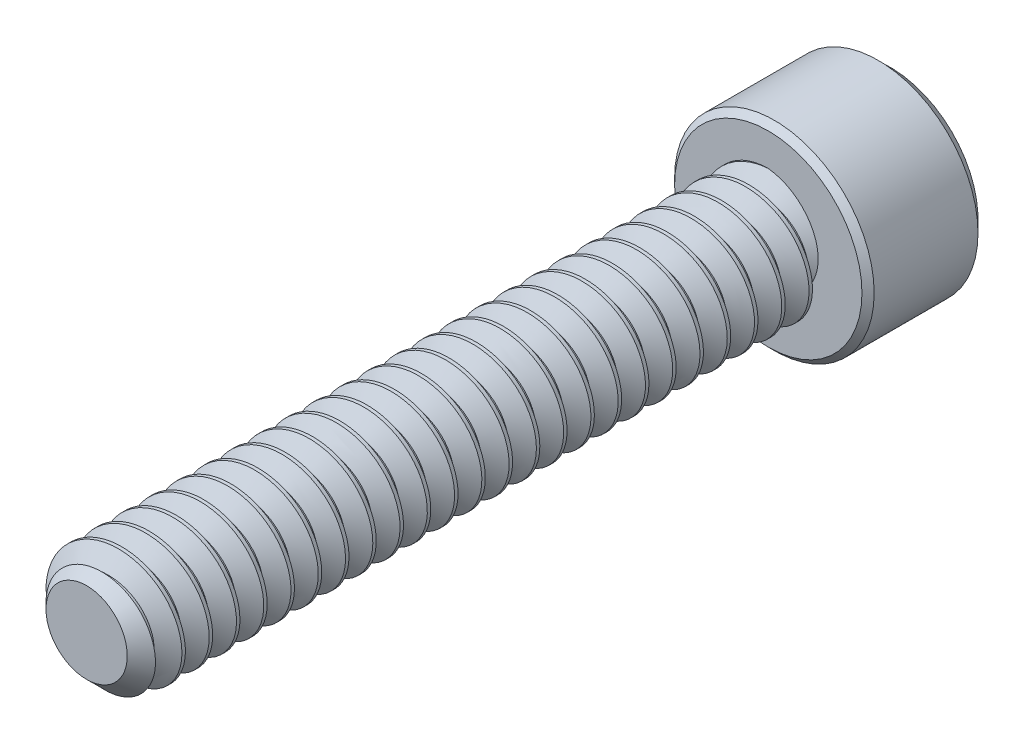
from build123d import *

# Parameters (mm, degrees)
SKETCH1_R          = 1.4224
EXTRUDE1_DEPTH     = 15.875
CHAMFER3_SIZE      = 0.47625
CUT_SWEEP1_PITCH   = 0.635
SKETCH6_R          = 2.3241
EXTRUDE2_DEPTH     = 2.8448
CUT_EXTRUDE1_DEPTH = 1.7859375
SKETCH8_R          = 1.374815329
CUT_EXTRUDE2_DEPTH = 0.28448
CUT_EXTRUDE2_DRAFT = -45
CHAMFER1_SIZE      = 0.28448
CHAMFER2_SIZE      = 0.14224


with BuildPart() as part:
    # Sketch1 → Extrude1 (new body)
    with BuildSketch(Plane.XY):
        Circle(SKETCH1_R)
    extrude(amount=-EXTRUDE1_DEPTH)

    # Chamfer3
    chamfer3_edges = [part.edges().sort_by_distance(p)[0] for p in [
        (-1.4224, 0, 0),
    ]]
    chamfer(chamfer3_edges, length=CHAMFER3_SIZE)

    # Cut-Sweep1: the profile of Sketch3 profile screwed along a right-hand helix of 26 turns, 6 arcs to a turn; built about Z, then put on its axis
    cut_sweep1_z = Axis((0, 0, 0), (0, 0, 1))
    cut_sweep1_corners = [(1.4227, 0, -0.555798205), (1.009955401, 0, -0.3175), (1.009955401, 0, -0.238125), (1.4227, 0, 0.000173205)]
    with BuildLine(mode=Mode.PRIVATE) as cut_sweep1_profile:
        Line(cut_sweep1_corners[0], cut_sweep1_corners[1])
        Line(cut_sweep1_corners[1], cut_sweep1_corners[2])
        Line(cut_sweep1_corners[2], cut_sweep1_corners[3])
        Line(cut_sweep1_corners[3], cut_sweep1_corners[0])
    cut_sweep1_cap = Face(cut_sweep1_profile.wire())
    cut_sweep1_turn_angles = [0, 30, 60, 90, 120, 150, 180, 210, 240, 270, 300, 330, 360]
    cut_sweep1_turn_weights = [1, 0.8660254037844387, 1, 0.8660254037844387, 1, 0.8660254037844387, 1, 0.8660254037844387, 1, 0.8660254037844387, 1, 0.8660254037844387, 1]
    cut_sweep1_turn_rails = [Edge.make_bspline([Vector(p[0], p[1], 0).rotate(cut_sweep1_z, cut_sweep1_turn_angles[k]) / cut_sweep1_turn_weights[k] + Vector(0, 0, p[2] + CUT_SWEEP1_PITCH * cut_sweep1_turn_angles[k] / 360) for k in range(13)], [0, 0, 0, 1, 1, 2, 2, 3, 3, 4, 4, 5, 5, 6, 6, 6], 2, cut_sweep1_turn_weights) for p in cut_sweep1_corners]
    cut_sweep1_turn_sides = [Face.make_surface_from_curves(cut_sweep1_turn_rails[p[0]], cut_sweep1_turn_rails[p[1]]) for p in [(0, 1), (1, 2), (2, 3), (3, 0)]]
    cut_sweep1 = Plane(origin=(0, 0, 0), x_dir=(0, 1, 0), z_dir=(0, 0, -1)) * Solid(Shell([*[p.moved(Location((0, 0, CUT_SWEEP1_PITCH * i))) for i in range(26) for p in cut_sweep1_turn_sides], cut_sweep1_cap, cut_sweep1_cap.rotate(cut_sweep1_z, 9360).moved(Location((0, 0, CUT_SWEEP1_PITCH * 9360 / 360)))]))
    add(cut_sweep1, mode=Mode.SUBTRACT)

    # Sketch6 → Extrude2 (add)
    with BuildSketch(Plane(origin=(0, 0, -15.875), x_dir=(-1, 0, 0), z_dir=(0, 0, -1))):
        Circle(SKETCH6_R)
    extrude(amount=EXTRUDE2_DEPTH)

    # Sketch7 → Cut-Extrude1 (cut)
    with BuildSketch(Plane(origin=(0, 0, -18.7198), x_dir=(-1, 0, 0), z_dir=(0, 0, -1))):
        Polygon((0, 1.374815329), (-1.190625, 0.687407664), (-1.190625, -0.687407664), (0, -1.374815329), (1.190625, -0.687407664), (1.190625, 0.687407664), align=None)
    extrude(amount=-CUT_EXTRUDE1_DEPTH, mode=Mode.SUBTRACT)


with BuildPart() as cut_extrude2_tool:
    # Sketch8 → Cut-Extrude2 (with draft: the straight prism first)
    with BuildSketch(Plane(origin=(0, 0, -18.7198), x_dir=(-1, 0, 0), z_dir=(0, 0, -1))):
        Circle(SKETCH8_R)
    extrude(amount=-CUT_EXTRUDE2_DEPTH)
    # Cut-Extrude2: the draft: its side faces are tilted about the plane it starts from
    cut_extrude2_sides = [cut_extrude2_tool.faces().sort_by_distance(p)[0] for p in [
        (1.374815329, 0, -18.57756),
    ]]
    draft(cut_extrude2_sides, Plane(origin=(0, 0, -18.7198), x_dir=(-1, 0, 0), z_dir=(0, 0, -1)), CUT_EXTRUDE2_DRAFT)


with BuildPart() as part_1:
    add(part.part)

    # Cut-Extrude2: cut by cut_extrude2_tool
    add(cut_extrude2_tool.part, mode=Mode.SUBTRACT)

    # Chamfer1
    chamfer1_edges = [part_1.edges().sort_by_distance(p)[0] for p in [
        (2.3241, 0, -18.7198),
    ]]
    chamfer(chamfer1_edges, length=CHAMFER1_SIZE)

    # Chamfer2
    chamfer2_edges = [part_1.edges().sort_by_distance(p)[0] for p in [
        (2.3241, 0, -15.875),
    ]]
    chamfer(chamfer2_edges, length=CHAMFER2_SIZE)


solid = part_1.part
